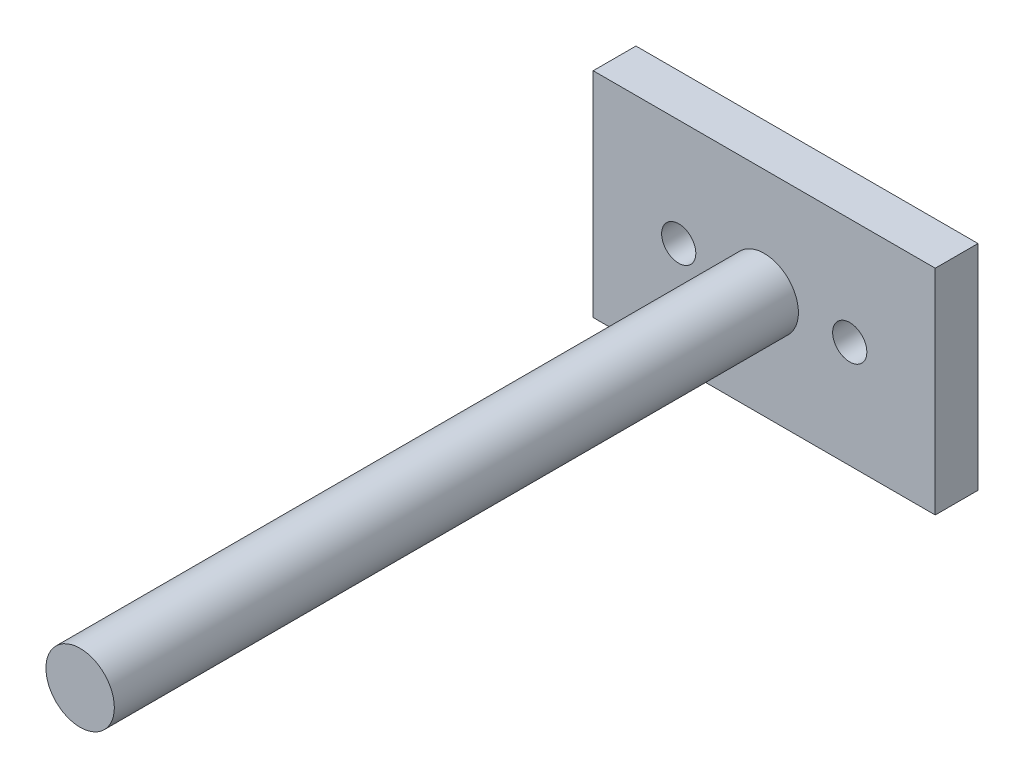
from build123d import *

# Parameters (mm, degrees)
ESBO_O1_R                = 4
RESSALTO_EXTRUS_O1_DEPTH = 80
ESBO_O1_3_W              = 40
ESBO_O1_3_H              = 25
ESBO_O1_3_R              = 2
RESSALTO_EXTRUS_O2_DEPTH = 5


with BuildPart() as part:
    # Esboço1 → Ressalto-extrusão1 (new body)
    with BuildSketch(Plane.XY):
        Circle(ESBO_O1_R)
    extrude(amount=RESSALTO_EXTRUS_O1_DEPTH)


with BuildPart() as body_2:
    # Esboço1<3> → Ressalto-extrusão2 (new body)
    with BuildSketch(Plane.XY):
        Rectangle(ESBO_O1_3_W, ESBO_O1_3_H)
        with Locations((-10, 0)):
            Circle(ESBO_O1_3_R, mode=Mode.SUBTRACT)
        with Locations((10, 0)):
            Circle(ESBO_O1_3_R, mode=Mode.SUBTRACT)
    extrude(amount=-RESSALTO_EXTRUS_O2_DEPTH)


solid = Compound([part.part, body_2.part])
